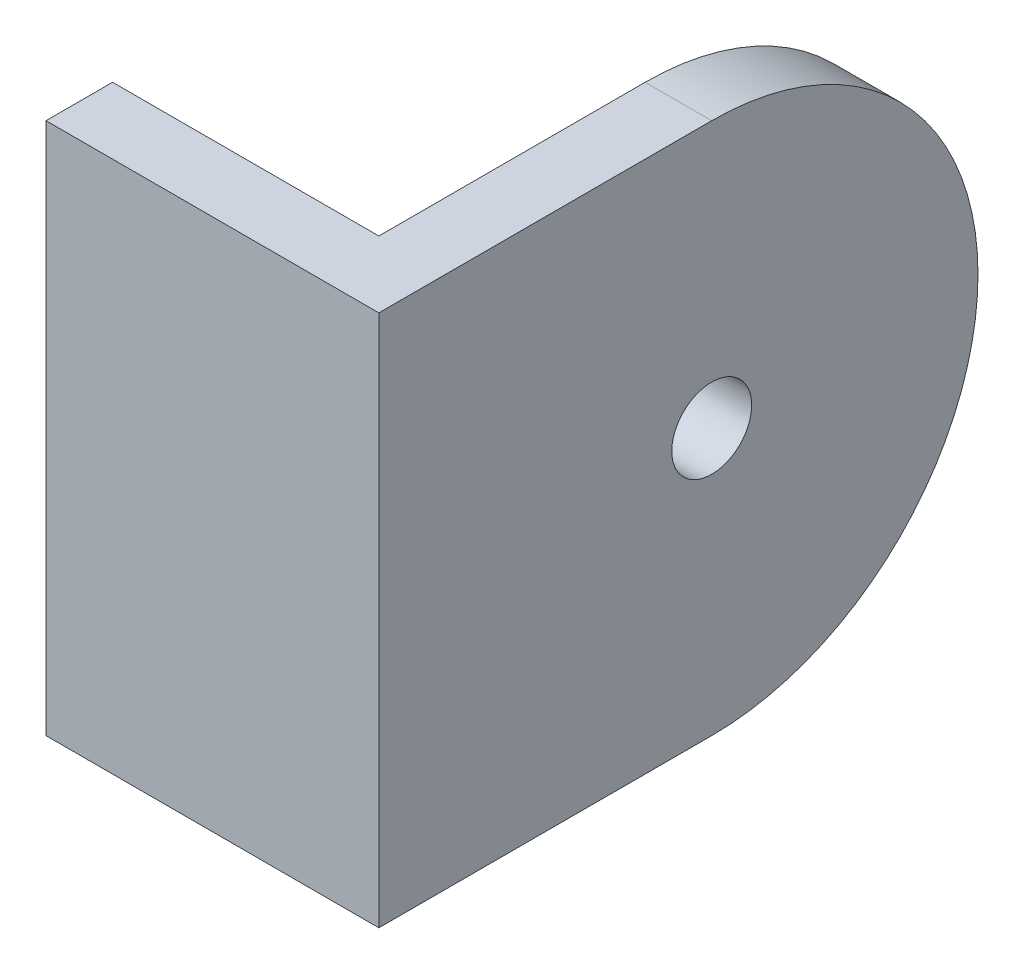
from build123d import *

# Parameters (mm, degrees)
BOSS_EXTRUDE1_DEPTH = 20
FILLET1_R           = 20
FILLET2_R           = 20
SKETCH2_R           = 3
CUT_EXTRUDE2_DEPTH  = 40


with BuildPart() as part:
    # Sketch1 → Boss-Extrude1 (new, symmetric)
    with BuildSketch(Plane(origin=(0, 0, 0), x_dir=(1, 0, 0), z_dir=(0, 1, 0))):
        Polygon((-4.418120101, 15.201487277), (0.581879899, 15.201487277), (0.581879899, -29.798512723), (-24.418120101, -29.798512723), (-24.418120101, -24.798512723), (-4.418120101, -24.798512723), align=None)
    extrude(amount=BOSS_EXTRUDE1_DEPTH, both=True)

    # Fillet1
    fillet1_edges = [part.edges().sort_by_distance(p)[0] for p in [
        (-1.918120101, -20, -15.201487277),
    ]]
    fillet(fillet1_edges, radius=FILLET1_R)

    # Fillet2
    fillet2_edges = [part.edges().sort_by_distance(p)[0] for p in [
        (-1.918120101, 20, -15.201487277),
    ]]
    fillet(fillet2_edges, radius=FILLET2_R - 0.0001)  # a hair under: the kernel refuses the full size

    # Sketch2 → Cut-Extrude2 (cut)
    with BuildSketch(Plane.ZY.offset(4.418120101)):
        with Locations((4.798512723, 0)):
            Circle(SKETCH2_R)
    extrude(amount=-CUT_EXTRUDE2_DEPTH, mode=Mode.SUBTRACT)


solid = part.part
